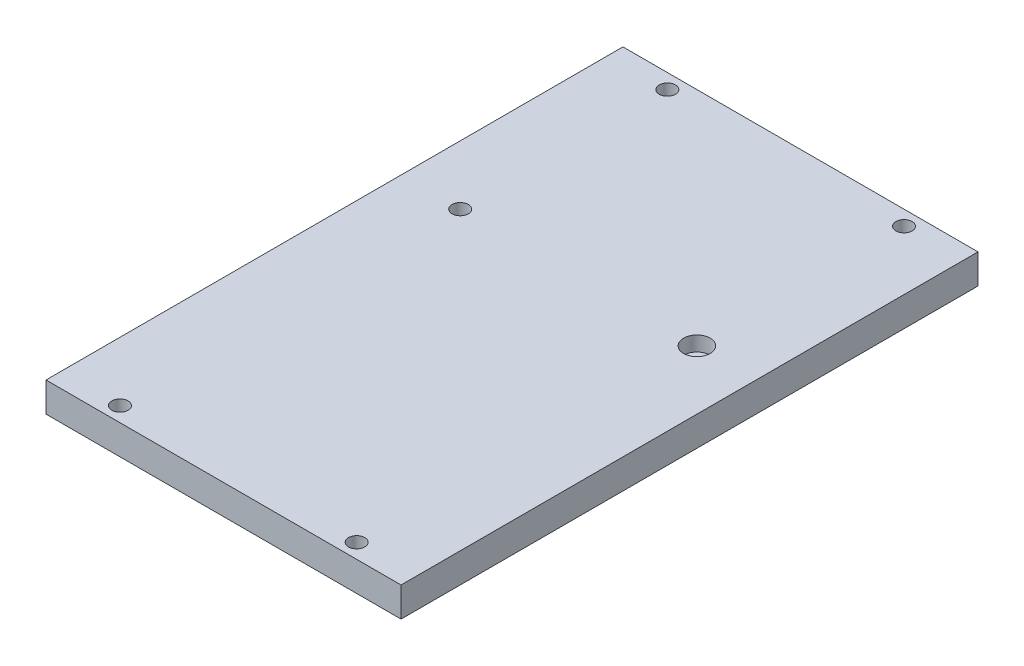
from build123d import *

# Parameters (mm, degrees)
SKETCH1_W           = 120
SKETCH1_H           = 195
BOSS_EXTRUDE1_DEPTH = 10
SKETCH2_R           = 2.75
CUT_EXTRUDE1_DEPTH  = 147.319672025
SKETCH3_R           = 4.5
CUT_EXTRUDE2_DEPTH  = 5


with BuildPart() as part:
    # Sketch1 → Boss-Extrude1 (new body)
    with BuildSketch(Plane(origin=(0, 0, 0), x_dir=(1, 0, 0), z_dir=(0, 1, 0))):
        with Locations((-17.427799272, -26.251292201)):
            Rectangle(SKETCH1_W, SKETCH1_H)
    extrude(amount=BOSS_EXTRUDE1_DEPTH)

    # Sketch2 → Cut-Extrude1 (cut, through all)
    with BuildSketch(Plane(origin=(0, 10, 0), x_dir=(-1, 0, 0), z_dir=(0, 1, 0))):
        with Locations((-22.572200728, 118.751292201)):
            Circle(SKETCH2_R)
        with Locations((57.427799272, 118.751292201)):
            Circle(SKETCH2_R)
        with Locations((-22.572200728, 3.751292201)):
            Circle(SKETCH2_R)
        with Locations((57.427799272, 3.751292201)):
            Circle(SKETCH2_R)
        with Locations((-22.572200728, -66.248707799)):
            Circle(SKETCH2_R)
        with Locations((57.427799272, -66.248707799)):
            Circle(SKETCH2_R)
    extrude(amount=-CUT_EXTRUDE1_DEPTH, mode=Mode.SUBTRACT)

    # Sketch3 → Cut-Extrude2 (cut)
    with BuildSketch(Plane(origin=(0, 10, 0), x_dir=(-1, 0, 0), z_dir=(0, 1, 0))):
        with Locations((-22.572200728, 3.751292201)):
            Circle(SKETCH3_R)
    extrude(amount=-CUT_EXTRUDE2_DEPTH, mode=Mode.SUBTRACT)


solid = part.part
